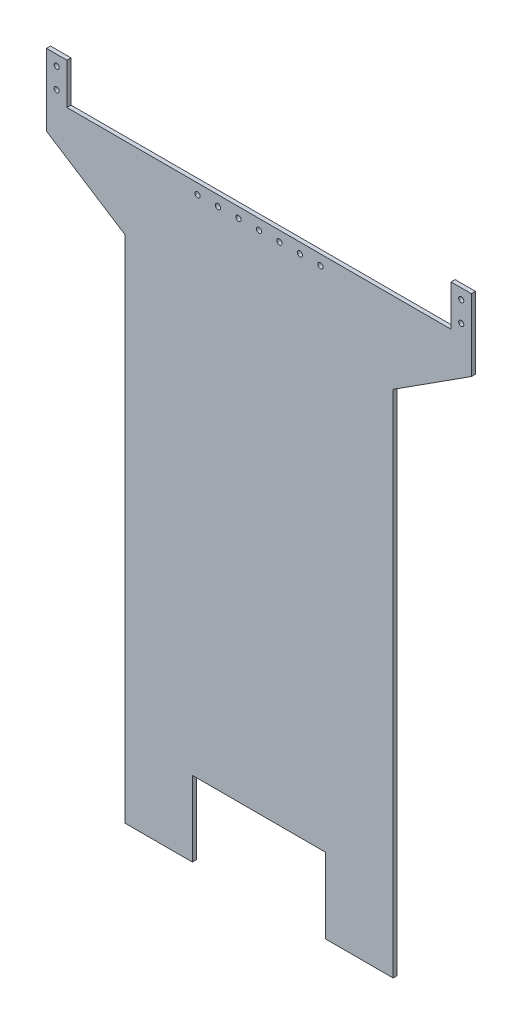
from build123d import *

# Parameters (mm, degrees)
SKETCH1_R           = 2.5
BOSS_EXTRUDE1_DEPTH = 4
SKETCH4_R           = 2.55
CUT_EXTRUDE1_DEPTH  = 662.866668307
SKETCH6_W           = 66
SKETCH6_H           = 8.48
CUT_EXTRUDE2_DEPTH  = 662.866668307
SKETCH7_W           = 66
SKETCH7_H           = 3.175
CUT_EXTRUDE3_DEPTH  = 662.866668307


with BuildPart() as part:
    # Sketch1 → Boss-Extrude1 (new body)
    with BuildSketch(Plane.XY):
        Polygon((131, 509.412038733), (131, 0), (65, 0), (65, 85), (-65, 85), (-65, 0), (-131, 0), (-131, 509.412038733), (-207.5, 558.486464942), (-207.5, 628.486464942), (-187.5, 628.486464942), (-187.5, 588.486464942), (187.5, 588.486464942), (187.5, 628.486464942), (207.5, 628.486464942), (207.5, 558.486464942), align=None)
        with Locations((197.5, 618.486464942)):
            Circle(SKETCH1_R, mode=Mode.SUBTRACT)
        with Locations((197.5, 598.486464942)):
            Circle(SKETCH1_R, mode=Mode.SUBTRACT)
        with Locations((-197.5, 598.486464942)):
            Circle(SKETCH1_R, mode=Mode.SUBTRACT)
        with Locations((-197.5, 618.486464942)):
            Circle(SKETCH1_R, mode=Mode.SUBTRACT)
    extrude(amount=-BOSS_EXTRUDE1_DEPTH)

    # Sketch4 → Cut-Extrude1 (cut, through all)
    with BuildSketch(Plane(origin=(0, 0, -4), x_dir=(-1, 0, 0), z_dir=(0, 0, -1))):
        with Locations((0, 578.486464942)):
            Circle(SKETCH4_R)
        with Locations((20, 578.486464942)):
            Circle(SKETCH4_R)
        with Locations((40, 578.486464942)):
            Circle(SKETCH4_R)
        with Locations((60, 578.486464942)):
            Circle(SKETCH4_R)
        with Locations((-20, 578.486464942)):
            Circle(SKETCH4_R)
        with Locations((-40, 578.486464942)):
            Circle(SKETCH4_R)
        with Locations((-60, 578.486464942)):
            Circle(SKETCH4_R)
    extrude(amount=-CUT_EXTRUDE1_DEPTH, mode=Mode.SUBTRACT)

    # Sketch6 → Cut-Extrude2 (cut, through all)
    with BuildSketch(Plane(origin=(0, 0, -4), x_dir=(-1, 0, 0), z_dir=(0, 0, -1))):
        with Locations((98, 4.24)):
            Rectangle(SKETCH6_W, SKETCH6_H)
        with Locations((-98, 4.24)):
            Rectangle(SKETCH6_W, SKETCH6_H)
    extrude(amount=-CUT_EXTRUDE2_DEPTH, mode=Mode.SUBTRACT)

    # Sketch7 → Cut-Extrude3 (cut, through all)
    with BuildSketch(Plane(origin=(0, 0, -4), x_dir=(-1, 0, 0), z_dir=(0, 0, -1))):
        with Locations((-98, 10.0675)):
            Rectangle(SKETCH7_W, SKETCH7_H)
        with Locations((98, 10.0675)):
            Rectangle(SKETCH7_W, SKETCH7_H)
    extrude(amount=-CUT_EXTRUDE3_DEPTH, mode=Mode.SUBTRACT)


solid = part.part
